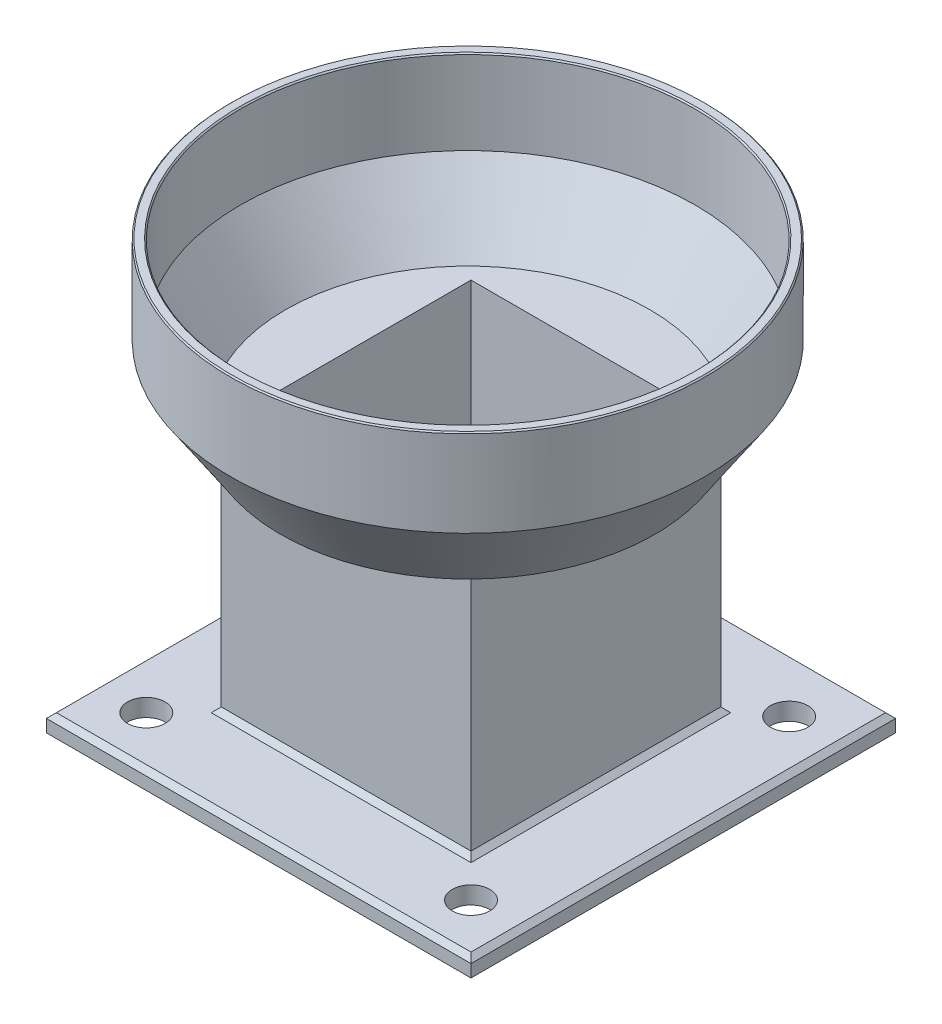
from build123d import *

# Parameters (mm, degrees)
ESQUISSE1_W             = 170
ESQUISSE1_H             = 170
BOSS_EXTRU_1_DEPTH      = 7
ESQUISSE2_W             = 100
ESQUISSE2_H             = 100
BOSS_EXTRU_2_DEPTH      = 100
COQUE1_START            = 4
COQUE1_OUTLINE_W        = 92
COQUE1_OUTLINE_H        = 92
COQUE1_DEPTH            = 168
COQUE1_START_2          = 138.211102451
COQUE1_2_OUTLINE_R      = 91
COQUE1_2_OUTLINE_W      = 92
COQUE1_2_OUTLINE_H      = 92
COQUE1_2_DEPTH          = 33.788897549
CHANFREIN1_SIZE         = 2
CHANFREIN2_SIZE         = 0.5
ESQUISSE4_R             = 7.5
ENL_V_MAT_EXTRU_1_DEPTH = 70


with BuildPart() as part:
    # Esquisse1 → Boss.-Extru.1 (new body)
    with BuildSketch(Plane(origin=(0, 0, 0), x_dir=(1, 0, 0), z_dir=(0, 1, 0))):
        with Locations((-39.850746269, -58.694029851)):
            Rectangle(ESQUISSE1_W, ESQUISSE1_H)
    extrude(amount=BOSS_EXTRU_1_DEPTH)

    # Esquisse2 → Boss.-Extru.2 (add)
    with BuildSketch(Plane(origin=(0, 7, 0), x_dir=(1, 0, 0), z_dir=(0, 1, 0))):
        with Locations((-39.850746269, -58.694029851)):
            Rectangle(ESQUISSE2_W, ESQUISSE2_H)
    extrude(amount=BOSS_EXTRU_2_DEPTH)

    # Esquisse3 → Révolution1 (revolve)
    with BuildSketch(Plane.XY.offset(60), mode=Mode.PRIVATE) as r_volution1_sk:
        Polygon((55.149253731, 137), (55.149253731, 172), (-39.850746269, 172), (-39.850746269, 107), (35.149253731, 107), align=None)
    revolve(r_volution1_sk.sketch.rotate(Axis((-39.850746269, 172, 60), (0, -1, 0)), 180), axis=Axis((-39.850746269, 172, 60), (0, -1, 0)))

    # Coque1: read off the stored shape, not the designer's step
    # Coque1 outline → Coque1 (cut)
    with BuildSketch(Plane(origin=(0, 0, 0), x_dir=(1, 0, 0), z_dir=(0, 1, 0)).offset(COQUE1_START)):
        with Locations((-39.850746269, -58.694029851)):
            Rectangle(COQUE1_OUTLINE_W, COQUE1_OUTLINE_H)
    extrude(amount=COQUE1_DEPTH, mode=Mode.SUBTRACT)

    # Coque1 2 outline → Coque1 2 (cut)
    with BuildSketch(Plane(origin=(0, 0, 0), x_dir=(1, 0, 0), z_dir=(0, 1, 0)).offset(COQUE1_START_2)):
        with Locations((-39.850746269, -60)):
            Circle(COQUE1_2_OUTLINE_R)
        with Locations((-39.850746269, -58.694029851)):
            Rectangle(COQUE1_2_OUTLINE_W, COQUE1_2_OUTLINE_H, mode=Mode.SUBTRACT)
    extrude(amount=COQUE1_2_DEPTH, mode=Mode.SUBTRACT)

    # Coque1 3 outline → Coque1 3 (revolve, cut)
    with BuildSketch(Plane(origin=(-39.850746269, 0, 60), x_dir=(1, 0, 0), z_dir=(0, 0, 1))):
        Polygon((44.694029851, 138.211102551), (44.694029851, 111), (72.859264966, 111), (91, 138.211102551), align=None)
    revolve(axis=Axis((-39.850746269, 0, 60), (0, 1, 0)), mode=Mode.SUBTRACT)

    # Chanfrein1
    chanfrein1_edges = [part.edges().sort_by_distance(p)[0] for p in [
        (45.149253731, 7, 58.694029851),
        (-89.850746269, 7, 58.694029851),
        (-39.850746269, 7, 108.694029851),
        (10.149253731, 7, 58.694029851),
        (-39.850746269, 7, 8.694029851),
        (-39.850746269, 7, -26.305970149),
        (-124.850746269, 7, 58.694029851),
        (-39.850746269, 7, 143.694029851),
    ]]
    chamfer(chanfrein1_edges, length=CHANFREIN1_SIZE)

    # Chanfrein2
    chanfrein2_edges = [part.edges().sort_by_distance(p)[0] for p in [
        (55.149253731, 172, 60),
        (-130.850746269, 172, 60),
    ]]
    chamfer(chanfrein2_edges, length=CHANFREIN2_SIZE)

    # Esquisse4 → Enlèv. mat.-Extru.1 (cut)
    with BuildSketch(Plane(origin=(0, 7, 0), x_dir=(1, 0, 0), z_dir=(0, 1, 0))):
        with Locations(Location((25.149253731, -123.694029851, 0), (0, 0, 270))):
            Circle(ESQUISSE4_R)
        with Locations(Location((25.149253731, 3.694029851, 0), (0, 0, 270))):
            Circle(ESQUISSE4_R)
        with Locations(Location((-104.850746269, -123.694029851, 0), (0, 0, 270))):
            Circle(ESQUISSE4_R)
        with Locations(Location((-104.850746269, 3.694029851, 0), (0, 0, 270))):
            Circle(ESQUISSE4_R)
    extrude(amount=-ENL_V_MAT_EXTRU_1_DEPTH, mode=Mode.SUBTRACT)


solid = part.part
